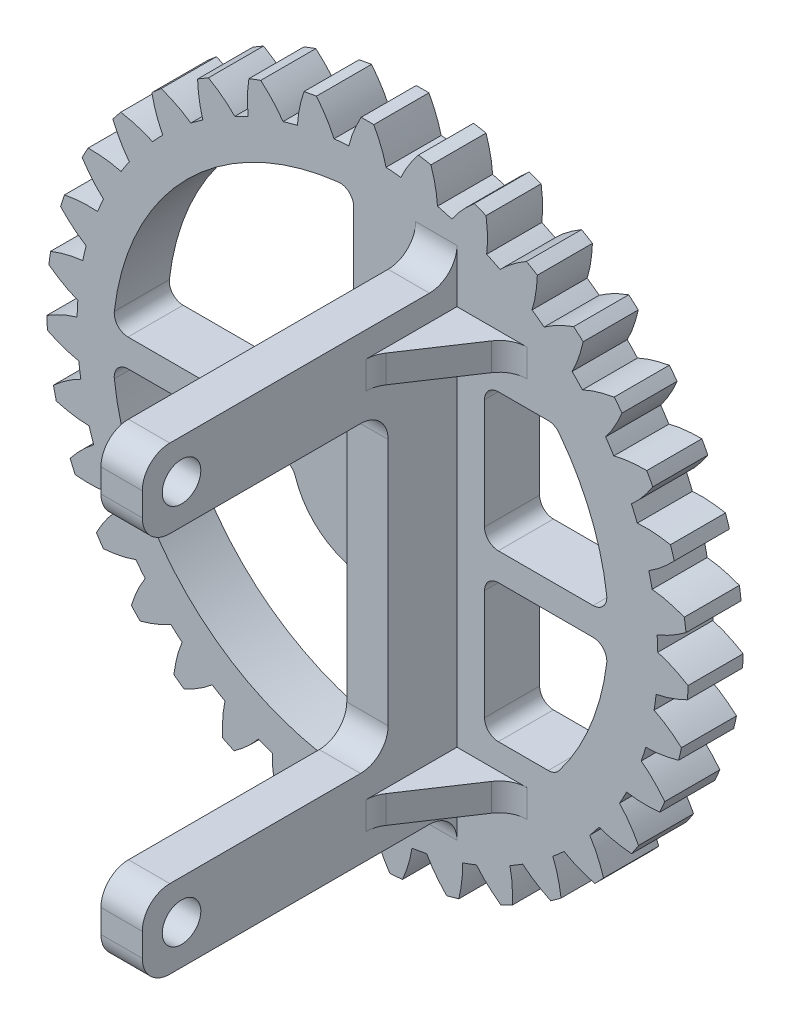
from build123d import *
from build123d.topology import SkipClean

# Parameters (mm, degrees)
SKETCH5_R           = 21.081692033
SKETCH5_R_2         = 1.5
EXTRUDE_BODY_DEPTH  = 2
EXTRUDE_TOOTH_DEPTH = 2
CIRPATTERN1_COUNT   = 35
SKETCH9_R           = 1.4
BOSS_EXTRUDE1_DEPTH = 1.5
BOSS_EXTRUDE2_DEPTH = 1
FILLET1_R           = 2
FILLET2_R           = 2
CUT_EXTRUDE1_DEPTH  = 41.073122313
CUT_EXTRUDE2_DEPTH  = 41.073122313
FILLET3_R           = 1


with BuildPart() as part:
    # Sketch5 → Extrude Body (new, symmetric)
    with BuildSketch(Plane.XY):
        Circle(SKETCH5_R)
        Circle(SKETCH5_R_2, mode=Mode.SUBTRACT)
    extrude(amount=EXTRUDE_BODY_DEPTH, both=True)

    # Sketch6 → Extrude Tooth (add, symmetric)
    with BuildSketch(Plane.XY):
        with BuildLine():
            Line((1.465202417, 20.140846192), (0.108834104, 1.496046503))
            ThreePointArc((0.108834104, 1.496046503), (0, 1.5), (-0.108834104, 1.496046503))
            Line((-0.108834104, 1.496046503), (-1.465202417, 20.140846192))
            add(Edge.make_bspline(
                [(-1.465202417, 20.140846192), (-1.47023579, 20.418102268), (-1.297549878, 21.518748855), (-0.855764864, 22.548595521), (-0.460198704, 23.277143318)],
                knots=[0, 0, 0, 0, 0.250016337, 1, 1, 1, 1], degree=3))
            ThreePointArc((-0.460198704, 23.277143318), (0, 23.281692033), (0.460198704, 23.277143318))
            add(Edge.make_bspline(
                [(1.465202417, 20.140846192), (1.47023579, 20.418102268), (1.297549878, 21.518748855), (0.855764864, 22.548595521), (0.460198704, 23.277143318)],
                knots=[0, 0, 0, 0, 0.250016337, 1, 1, 1, 1], degree=3))
        make_face()
    extrude_tooth = extrude(amount=EXTRUDE_TOOTH_DEPTH, both=True)

    # CirPattern1: Extrude Tooth ×35 about axis
    with SkipClean():  # the faces are left unmerged after this step: merging them gives an invalid solid
        cirpattern1_axis = Axis((0, 0, 2), (0, 0, -1))
        for i in range(1, CIRPATTERN1_COUNT):
            add(extrude_tooth.rotate(cirpattern1_axis, i * 360 / CIRPATTERN1_COUNT))

    # Sketch9 → Boss-Extrude1 (add, symmetric)
    with SkipClean():  # the faces are left unmerged after this step: merging them gives an invalid solid
        with BuildSketch(Plane(origin=(5, 0, 0), x_dir=(0, 0, -1), z_dir=(1, 0, 0))):
            Polygon((-2, 16.7), (-24.85, 16.7), (-24.85, 11), (-7, 11), (-7, -11), (-24.85, -11), (-24.85, -16.7), (-2, -16.7), align=None)
            with Locations((-22, 13.85)):
                Circle(SKETCH9_R, mode=Mode.SUBTRACT)
            with Locations(Location((-22, -13.85, 0), (0, 0, 180))):
                Circle(SKETCH9_R, mode=Mode.SUBTRACT)
        extrude(amount=BOSS_EXTRUDE1_DEPTH, both=True)

    # Sketch10 → Boss-Extrude2 (add, symmetric)
    with SkipClean():  # the faces are left unmerged after this step: merging them gives an invalid solid
        with BuildSketch(Plane(origin=(0, 13.85, 0), x_dir=(-1, 0, 0), z_dir=(0, -1, 0))):
            Polygon((-6.5, -2), (-10.5, -2), (-6.5, -8), align=None)
        boss_extrude2 = extrude(amount=BOSS_EXTRUDE2_DEPTH, both=True)

    # Mirror1: Boss-Extrude2 across plane
    with SkipClean():  # the faces are left unmerged after this step: merging them gives an invalid solid
        add(boss_extrude2.mirror(Plane.ZX))

    # Fillet1
    fillet1_edges = [part.edges().sort_by_distance(p)[0] for p in [
        (5, 16.7, 24.85),
        (5, 11, 24.85),
        (5, 11, 7),
        (5, -11, 7),
        (5, -11, 24.85),
        (5, -16.7, 24.85),
    ]]
    fillet(fillet1_edges, radius=FILLET1_R)

    # Fillet2
    # the kernel refuses this fillet: 2 mm, written as the material it adds along each edge
    with BuildSketch(Plane(origin=(5.943116201, -16.7, 2), x_dir=(0, 0, 1), z_dir=(-1, 0, 0))) as fillet2_piece_1:
        with BuildLine():
            CenterArc((FILLET2_R, -FILLET2_R), FILLET2_R, 90, 90)
            Line((0, -FILLET2_R), (0, 0))
            Line((0, 0), (FILLET2_R, 0))
        make_face()
    extrude(amount=2.443116201)
    with BuildSketch(Plane(origin=(6.5, 16.7, 2), x_dir=(0, 0, 1), z_dir=(-1, 0, 0))) as fillet2_piece_2:
        with BuildLine():
            CenterArc((FILLET2_R, FILLET2_R), FILLET2_R, 180, 90)
            Line((0, FILLET2_R), (0, 0))
            Line((0, 0), (FILLET2_R, 0))
        make_face()
    extrude(amount=3)
    with BuildSketch(Plane(origin=(6.5, 12.85, 8), x_dir=(0, 0, 1), z_dir=(0, 1, 0))) as fillet2_piece_3:
        with BuildLine():
            CenterArc((FILLET2_R * 0.302775637732, FILLET2_R), FILLET2_R, 236.309932474, 33.690067526)
            Line((-FILLET2_R * 0.251924558493, FILLET2_R * 0.167949705662), (0, 0))
            Line((0, 0), (FILLET2_R * 0.302775637732, 0))
        make_face()
    extrude(amount=2)
    with BuildSketch(Plane(origin=(10.5, 14.85, 2), x_dir=(1, 0, 0), z_dir=(0, -1, 0)), Plane(origin=(10.5, -14.85, 2), x_dir=(-0.5547001962252295, 0, 0.8320502943378435), z_dir=(0, 1, 0))) as fillet2_piece_4:
        with BuildLine():
            CenterArc((FILLET2_R * 0.535183758488, FILLET2_R), FILLET2_R, 213.690067526, 56.309932474)
            Line((-FILLET2_R * 0.29686653585, FILLET2_R * 0.445299803775), (0, 0))
            Line((0, 0), (FILLET2_R * 0.535183758488, 0))
        make_face()
    extrude(amount=2)
    with BuildSketch(Plane(origin=(6.5, -12.85, 8), x_dir=(0, 0, 1), z_dir=(0, -1, 0))) as fillet2_piece_5:
        with BuildLine():
            CenterArc((FILLET2_R * 0.302775637732, -FILLET2_R), FILLET2_R, 90, 33.690067526)
            Line((-FILLET2_R * 0.251924558493, -FILLET2_R * 0.167949705662), (0, 0))
            Line((0, 0), (FILLET2_R * 0.302775637732, 0))
        make_face()
    extrude(amount=2)
    with BuildSketch(Plane(origin=(6.5, -16.7, 2), x_dir=(0, 0, 1), z_dir=(-1, 0, 0))) as fillet2_piece_6:
        with BuildLine():
            CenterArc((FILLET2_R, -FILLET2_R), FILLET2_R, 90, 90)
            Line((0, -FILLET2_R), (0, 0))
            Line((0, 0), (FILLET2_R, 0))
        make_face()
    extrude(amount=0.556883799)

    # Sketch11 → Cut-Extrude1 (cut, through all)
    with BuildSketch(Plane.XY.offset(2)):
        with BuildLine():
            Line((-1, 18.472953202), (-1, 5.408326913))
            ThreePointArc((-1, 5.408326913), (-3.889087297, 3.889087297), (-5.408326913, 1))
            Line((-5.408326913, 1), (-18.472953202, 1))
            ThreePointArc((-18.472953202, 1), (-13.081475452, 13.081475452), (-1, 18.472953202))
        make_face()
        with BuildLine():
            Line((-18.472953202, -1), (-5.408326913, -1))
            ThreePointArc((-5.408326913, -1), (-3.889087297, -3.889087297), (-1, -5.408326913))
            Line((-1, -5.408326913), (-1, -18.472953202))
            ThreePointArc((-1, -18.472953202), (-13.081475452, -13.081475452), (-18.472953202, -1))
        make_face()
    extrude(amount=-CUT_EXTRUDE1_DEPTH, mode=Mode.SUBTRACT)

    # Sketch12 → Cut-Extrude2 (cut, through all)
    with BuildSketch(Plane.XY.offset(2)):
        with BuildLine():
            Line((13.610657589, 11), (8.5, 11))
            Line((8.5, 11), (8.5, 1))
            Line((8.5, 1), (17.47140521, 1))
            ThreePointArc((17.47140521, 1), (16.325552271, 6.302883709), (13.610657589, 11))
        make_face()
        with BuildLine():
            Line((8.5, -1), (17.47140521, -1))
            ThreePointArc((17.47140521, -1), (16.325552271, -6.302883709), (13.610657589, -11))
            Line((13.610657589, -11), (8.5, -11))
            Line((8.5, -11), (8.5, -1))
        make_face()
    extrude(amount=-CUT_EXTRUDE2_DEPTH, mode=Mode.SUBTRACT)

    # Fillet3
    # the kernel refuses this fillet: 1 mm, written as the material it adds along each edge
    with BuildSketch(Plane(origin=(-5.408326913, 1, 2), x_dir=(-1, 0, 0), z_dir=(0, 0, -1)), Plane(origin=(-1, -5.408326913, 2), x_dir=(0, -1, 0), z_dir=(0, 0, -1))) as fillet3_piece_1:
        with BuildLine():
            CenterArc((0.776331525, 1), FILLET3_R, 197.920213139, 72.079786861)
            ThreePointArc((-0.175154388, 0.692307692), (-0.076329158, 0.348999608), (0, 0))
            Line((0, 0), (0.776331525, 0))
        make_face()
    extrude(amount=4)
    with BuildSketch(Plane(origin=(-18.472953202, 1, 2), x_dir=(0.08420835261524173, 0.9964481689229134, 0), z_dir=(0, 0, -1)), Plane(origin=(-1, -18.472953202, 2), x_dir=(-0.9964481689229139, 0.08420835261523857, 0), z_dir=(0, 0, -1))) as fillet3_piece_2:
        with BuildLine():
            CenterArc((1.088034399, 0.999543175), FILLET3_R, 175.169496396, 96.562427868)
            Line((0.09158623, 1.083751528), (0, 0))
            ThreePointArc((0, 0), (0.559128788, -0.008451255), (1.118257576, 0))
        make_face()
    extrude(amount=4)
    with BuildSketch(Plane(origin=(-1, 18.472953202, 2), x_dir=(-0.9964481689229134, -0.084208352615242, 0), z_dir=(0, 0, -1)), Plane(origin=(-18.472953202, -1, 2), x_dir=(0.08420835261523903, -0.9964481689229138, 0), z_dir=(0, 0, -1))) as fillet3_piece_3:
        with BuildLine():
            CenterArc((1.088034399, -0.999543175), FILLET3_R, 88.268075736, 96.562427868)
            Line((0.09158623, -1.083751528), (0, 0))
            ThreePointArc((0, 0), (0.559128788, 0.008451255), (1.118257576, 0))
        make_face()
    extrude(amount=4)
    with BuildSketch(Plane(origin=(-1, 5.408326913, 2), x_dir=(0, 1, 0), z_dir=(0, 0, -1)), Plane(origin=(-5.408326913, -1, 2), x_dir=(-1, 0, 0), z_dir=(0, 0, -1))) as fillet3_piece_4:
        with BuildLine():
            CenterArc((0.776331525, -1), FILLET3_R, 90, 72.079786861)
            ThreePointArc((-0.175154388, -0.692307692), (-0.076329158, -0.348999608), (0, 0))
            Line((0, 0), (0.776331525, 0))
        make_face()
    extrude(amount=4)
    with BuildSketch(Plane(origin=(13.610657589, 11, 2), x_dir=(-1, 0, 0), z_dir=(0, 0, -1))) as fillet3_piece_5:
        with BuildLine():
            CenterArc((0.48625284, -1), FILLET3_R, 90, 52.694799034)
            ThreePointArc((-0.309165629, -0.393939394), (-0.155991983, -0.195863775), (0, 0))
            Line((0, 0), (0.48625284, 0))
        make_face()
    extrude(amount=4)
    with BuildSketch(Plane(origin=(17.47140521, 1, 2), x_dir=(-1, 0, 0), z_dir=(0, 0, -1))) as fillet3_piece_6:
        with BuildLine():
            CenterArc((1.093065855, 1), FILLET3_R, 173.037937309, 96.962062691)
            ThreePointArc((0.100439228, 1.121212121), (0.04120192, 0.561413874), (0, 0))
            Line((0, 0), (1.093065855, 0))
        make_face()
    extrude(amount=4)
    with BuildSketch(Plane(origin=(8.5, 1, 2), x_dir=(0, 1, 0), z_dir=(0, 0, -1)), Plane(origin=(8.5, 11, 2), x_dir=(1, 0, 0), z_dir=(0, 0, -1)), Plane(origin=(8.5, -11, 2), x_dir=(0, 1, 0), z_dir=(0, 0, -1)), Plane(origin=(8.5, -1, 2), x_dir=(1, 0, 0), z_dir=(0, 0, -1))) as fillet3_piece_7:
        with BuildLine():
            CenterArc((FILLET3_R, FILLET3_R), FILLET3_R, 180, 90)
            Line((0, FILLET3_R), (0, 0))
            Line((0, 0), (FILLET3_R, 0))
        make_face()
    extrude(amount=4)
    with BuildSketch(Plane(origin=(17.47140521, -1, 2), x_dir=(-0.08922364994483856, -0.9960116165439643, 0), z_dir=(0, 0, -1))) as fillet3_piece_8:
        with BuildLine():
            CenterArc((1.093538942, 0.99948264), FILLET3_R, 174.881054175, 96.962062691)
            Line((0.097527325, 1.08870629), (0, 0))
            ThreePointArc((0, 0), (0.562850926, -0.009053804), (1.125701852, 0))
        make_face()
    extrude(amount=4)
    with BuildSketch(Plane(origin=(13.610657589, -11, 2), x_dir=(0.6173792128740053, 0.7866656898016294, 0), z_dir=(0, 0, -1))) as fillet3_piece_9:
        with BuildLine():
            CenterArc((0.486463294, -0.999897639), FILLET3_R, 89.180198686, 52.694799034)
            Line((-0.300202396, -0.382518426), (0, 0))
            ThreePointArc((0, 0), (0.250385519, 0.001791318), (0.500771038, 0))
        make_face()
    extrude(amount=4)


solid = part.part
